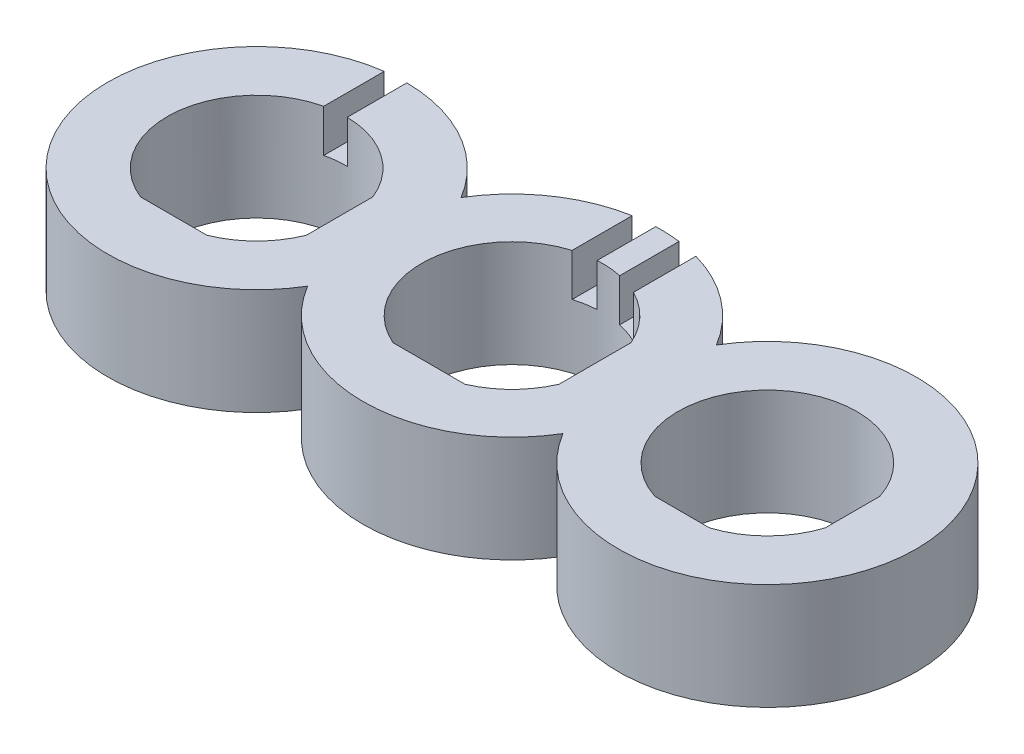
from build123d import *

# Parameters (mm, degrees)
SKETCH_1_R          = 7
EXTRUDE_1_DEPTH     = 5
SKETCH_2_R          = 7
EXTRUDE_2_DEPTH     = 5
SKETCH_3_R          = 7
EXTRUDE_3_DEPTH     = 5
SKETCH_4_W          = 1
SKETCH_4_H          = 6.733120112
SKETCH_4_H_2        = 7.353904236
CUT_EXTRUDE_7_DEPTH = 2


with BuildPart() as part:
    # Эскиз1 → Вытянуть1 (new body)
    with BuildSketch(Plane(origin=(0, 0, 0), x_dir=(1, 0, 0), z_dir=(0, 1, 0))):
        Circle(SKETCH_1_R)
        with BuildLine():
            Line((3.9, -1.558845727), (3.9, 1.558845727))
            ThreePointArc((3.9, 1.558845727), (-2.969848481, 2.969848481), (-1.558845727, -3.9))
            Line((-1.558845727, -3.9), (1.558845727, -3.9))
            ThreePointArc((1.558845727, -3.9), (2.969848481, -2.969848481), (3.9, -1.558845727))
        make_face(mode=Mode.SUBTRACT)
    extrude(amount=EXTRUDE_1_DEPTH)

    # Эскиз2 → Вытянуть2 (add)
    with BuildSketch(Plane(origin=(0, 0, 0), x_dir=(1, 0, 0), z_dir=(0, 1, 0))):
        with Locations((12, 0)):
            Circle(SKETCH_2_R)
        with BuildLine():
            Line((15.9, 1.688934575), (15.9, -1.688934575))
            ThreePointArc((15.9, -1.688934575), (15.00520382, -3.00520382), (13.688934575, -3.9))
            Line((13.688934575, -3.9), (10.311065425, -3.9))
            ThreePointArc((10.311065425, -3.9), (8.99479618, 3.00520382), (15.9, 1.688934575))
        make_face(mode=Mode.SUBTRACT)
    extrude(amount=EXTRUDE_2_DEPTH)

    # Эскиз3 → Вытянуть3 (add)
    with BuildSketch(Plane(origin=(0, 0, 0), x_dir=(1, 0, 0), z_dir=(0, 1, 0))):
        with Locations((24, 0)):
            Circle(SKETCH_3_R)
        with BuildLine():
            Line((28, 1.280624847), (28, -1.280624847))
            ThreePointArc((28, -1.280624847), (26.969848481, -2.969848481), (25.280624847, -4))
            Line((25.280624847, -4), (22.719375153, -4))
            ThreePointArc((22.719375153, -4), (21.030151519, 2.969848481), (28, 1.280624847))
        make_face(mode=Mode.SUBTRACT)
    extrude(amount=EXTRUDE_3_DEPTH)

    # Эскиз4 → Вытянуть7 (cut)
    with BuildSketch(Plane(origin=(0, 5, 0), x_dir=(1, 0, 0), z_dir=(0, 1, 0))):
        with Locations((-0.44096135, 5.658686052)):
            Rectangle(SKETCH_4_W, SKETCH_4_H)
        with Locations((11.258431752, 5.34829399)):
            Rectangle(SKETCH_4_W, SKETCH_4_H_2)
        with Locations((13.407299873, 5.34829399)):
            Rectangle(SKETCH_4_W, SKETCH_4_H_2)
    extrude(amount=-CUT_EXTRUDE_7_DEPTH, mode=Mode.SUBTRACT)


solid = part.part
